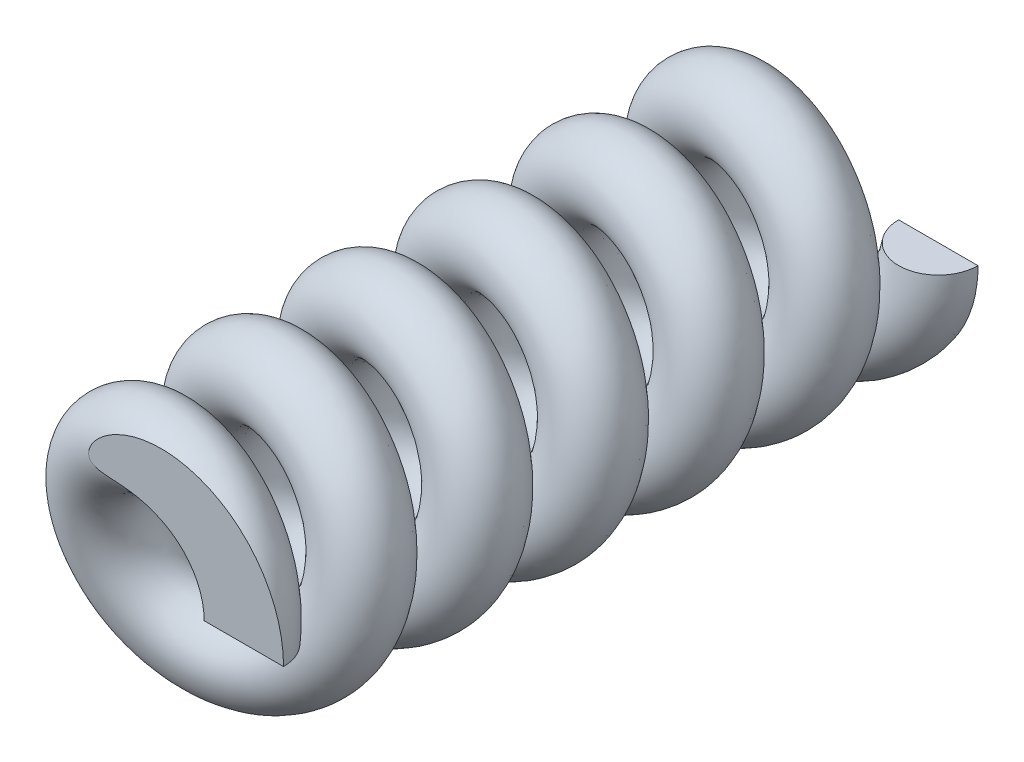
from build123d import *

# Parameters (mm, degrees)
WYCI_GNI_CIE_PO_CIE_CE1_PITCH  = 2.916666667
WYCI_GNI_CIE_PO_CIE_CE1_HEIGHT = 17.5
WYCI_GNI_CIE_PO_CIE_CE1_RADIUS = 2.5
SZKIC2_R                       = 1


with BuildPart() as part:
    # Wyciągnięcie po ścieżce1: sweep along a helix
    with BuildLine() as wyci_gni_cie_po_cie_ce1_path:
        Helix(WYCI_GNI_CIE_PO_CIE_CE1_PITCH, WYCI_GNI_CIE_PO_CIE_CE1_HEIGHT, WYCI_GNI_CIE_PO_CIE_CE1_RADIUS, center=(0, 0, 0), direction=(0, 0, 1), lefthand=True)
    # Szkic2 → Wyciągnięcie po ścieżce1 (sweep)
    with BuildSketch(Plane(origin=(0, 0, 0), x_dir=(1, 0, 0), z_dir=(0, 1, 0))):
        with Locations((2.5, 0)):
            Circle(SZKIC2_R)
    sweep(path=wyci_gni_cie_po_cie_ce1_path.line, is_frenet=True)

    # Cięcie powierzchnią1
    split(bisect_by=Plane.XY, keep=Keep.TOP)

    # Cięcie powierzchnią2
    split(bisect_by=Plane.XY.offset(17.5), keep=Keep.BOTTOM)


solid = part.part
